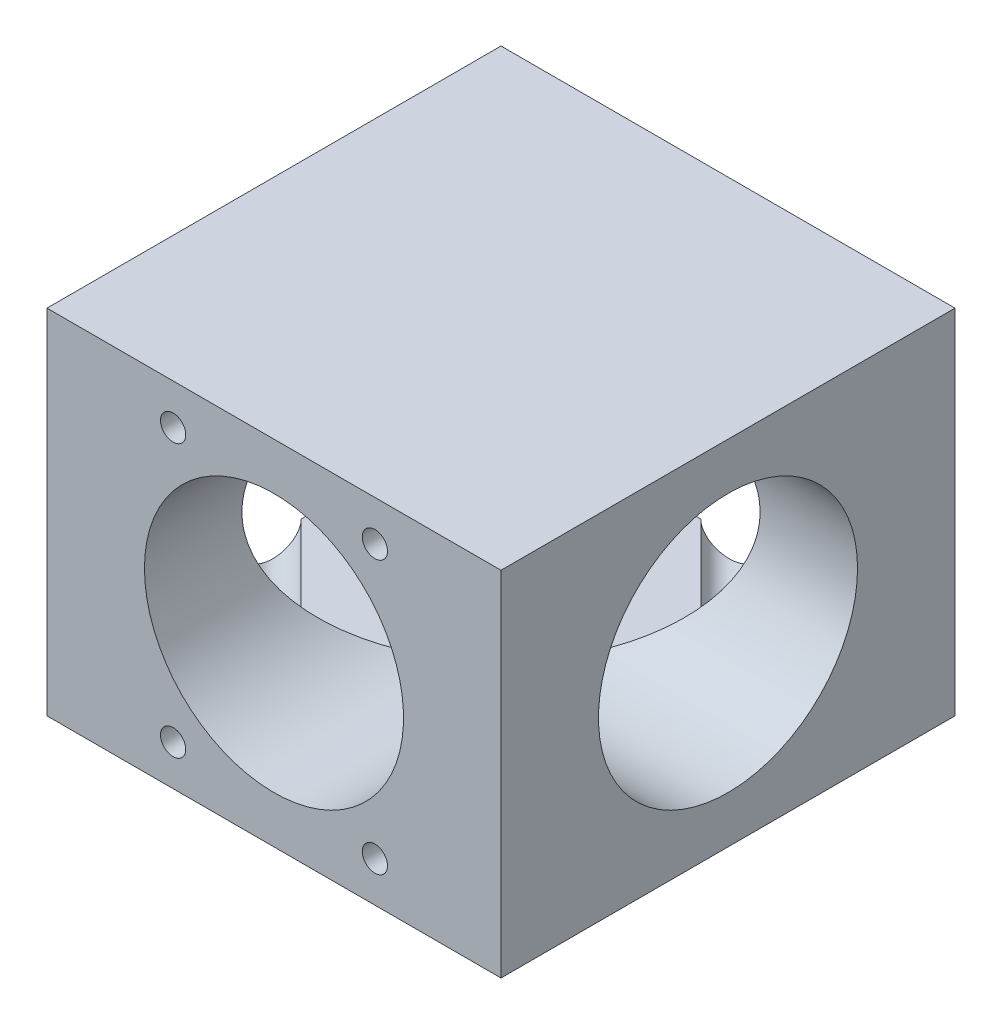
from build123d import *

# Parameters (mm, degrees)
SKETCH1_W             = 45
SKETCH1_H             = 45
BOSS_EXTRUDE1_DEPTH   = 17.5
CUT_EXTRUDE1_REACH    = 55.268
SKETCH2_R             = 12.8397
SKETCH3_R             = 12.8397
CUT_EXTRUDE2_DEPTH    = 54.268189382
CUT_EXTRUDE3_DEPTH    = 13.2
CUT_EXTRUDE4_DEPTH    = 31.819805153
M3_TAPPED_HOLE1_D     = 2.5
M3_TAPPED_HOLE1_DEPTH = 6.5
M3_TAPPED_HOLE1_TIP   = 0.751075774
M3_TAPPED_HOLE2_D     = 2.5
M3_TAPPED_HOLE2_DEPTH = 5.5
M3_TAPPED_HOLE2_TIP   = 0.751075774
M2_TAPPED_HOLE1_D     = 1.6
M2_TAPPED_HOLE1_DEPTH = 5.2
M2_TAPPED_HOLE1_TIP   = 0.480688495


# Read off the part's stored shape, not the designer's step: Cut-Extrude4
with BuildPart() as part:
    # Sketch1 → Boss-Extrude1 (new, symmetric)
    with BuildSketch(Plane(origin=(0, 0, 0), x_dir=(1, 0, 0), z_dir=(0, 1, 0))):
        Rectangle(SKETCH1_W, SKETCH1_H)
    extrude(amount=BOSS_EXTRUDE1_DEPTH, both=True)

    # Sketch2 → Cut-Extrude1 (cut, up to next)
    with BuildSketch(Plane(origin=(22.5, 0, 0), x_dir=(0, 0, -1), z_dir=(1, 0, 0)), mode=Mode.PRIVATE) as cut_extrude1_sk1:
        Circle(SKETCH2_R)
    cut_extrude1_tool1 = extrude(cut_extrude1_sk1.sketch, amount=-CUT_EXTRUDE1_REACH, mode=Mode.PRIVATE) & part.part
    add(cut_extrude1_tool1.solids().sort_by_distance((22.5, 0, 0))[0], mode=Mode.SUBTRACT)

    # Sketch3 → Cut-Extrude2 (cut, through all)
    with BuildSketch(Plane(origin=(0, 0, -22.5), x_dir=(-1, 0, 0), z_dir=(0, 0, -1))):
        Circle(SKETCH3_R)
    extrude(amount=-CUT_EXTRUDE2_DEPTH, mode=Mode.SUBTRACT)

    # Sketch5 → Cut-Extrude3 (cut, symmetric)
    with BuildSketch(Plane(origin=(0, 0, 0), x_dir=(1, 0, 0), z_dir=(0, 1, 0))):
        Polygon((-12.727922061, -12.727922061), (12.727922061, 12.727922061), (11.914749263, 13.54109486), (-13.54109486, -11.914749263), align=None)
    extrude(amount=CUT_EXTRUDE3_DEPTH, both=True, mode=Mode.SUBTRACT)

    # Cut-Extrude4 outline → Cut-Extrude4 (cut)
    with BuildSketch(Plane(origin=(0, 0, 0), x_dir=(-0.7071067811865486, 0, 0.7071067811865465), z_dir=(-0.7071067811865465, 0, -0.7071067811865486))):
        with BuildLine():
            ThreePointArc((-14, 13.2), (-16, 15.2), (-18, 13.2))
            Line((-18, 13.2), (-18, -13.2))
            ThreePointArc((-18, -13.2), (-16, -15.2), (-14, -13.2))
            Line((-14, -13.2), (14, -13.2))
            ThreePointArc((14, -13.2), (16, -15.2), (18, -13.2))
            Line((18, -13.2), (18, 13.2))
            ThreePointArc((18, 13.2), (16, 15.2), (14, 13.2))
            Line((14, 13.2), (-14, 13.2))
        make_face()
    extrude(amount=CUT_EXTRUDE4_DEPTH, mode=Mode.SUBTRACT)

    # M3 Tapped Hole1
    with Locations(Plane.XY.offset(22.5)):
        with Locations((-10, -13.5), (10, -13.5), (10, 13.5), (-10, 13.5)):
            Hole(M3_TAPPED_HOLE1_D / 2, depth=M3_TAPPED_HOLE1_DEPTH)
            with Locations((0, 0, -(M3_TAPPED_HOLE1_DEPTH + M3_TAPPED_HOLE1_TIP / 2))):  # 118° drill point
                Cone(0, M3_TAPPED_HOLE1_D / 2, M3_TAPPED_HOLE1_TIP, mode=Mode.SUBTRACT)

    # M3 Tapped Hole2
    with Locations(Plane(origin=(0, 0, -22.5), x_dir=(-1, 0, 0), z_dir=(0, 0, -1))):
        with Locations((-10, 13.5), (-10, -13.5)):
            Hole(M3_TAPPED_HOLE2_D / 2, depth=M3_TAPPED_HOLE2_DEPTH)
            with Locations((0, 0, -(M3_TAPPED_HOLE2_DEPTH + M3_TAPPED_HOLE2_TIP / 2))):  # 118° drill point
                Cone(0, M3_TAPPED_HOLE2_D / 2, M3_TAPPED_HOLE2_TIP, mode=Mode.SUBTRACT)

    # M2 Tapped Hole1
    with Locations(Plane(origin=(0, 0, 0), x_dir=(-0.7071067811865486, 0, 0.7071067811865465), z_dir=(-0.7071067811865465, 0, -0.7071067811865486))):
        with Locations((-16, -13.75), (-16, 13.75), (16, 13.75), (16, -13.75)):
            Hole(M2_TAPPED_HOLE1_D / 2, depth=M2_TAPPED_HOLE1_DEPTH)
            with Locations((0, 0, -(M2_TAPPED_HOLE1_DEPTH + M2_TAPPED_HOLE1_TIP / 2))):  # 118° drill point
                Cone(0, M2_TAPPED_HOLE1_D / 2, M2_TAPPED_HOLE1_TIP, mode=Mode.SUBTRACT)


solid = part.part
